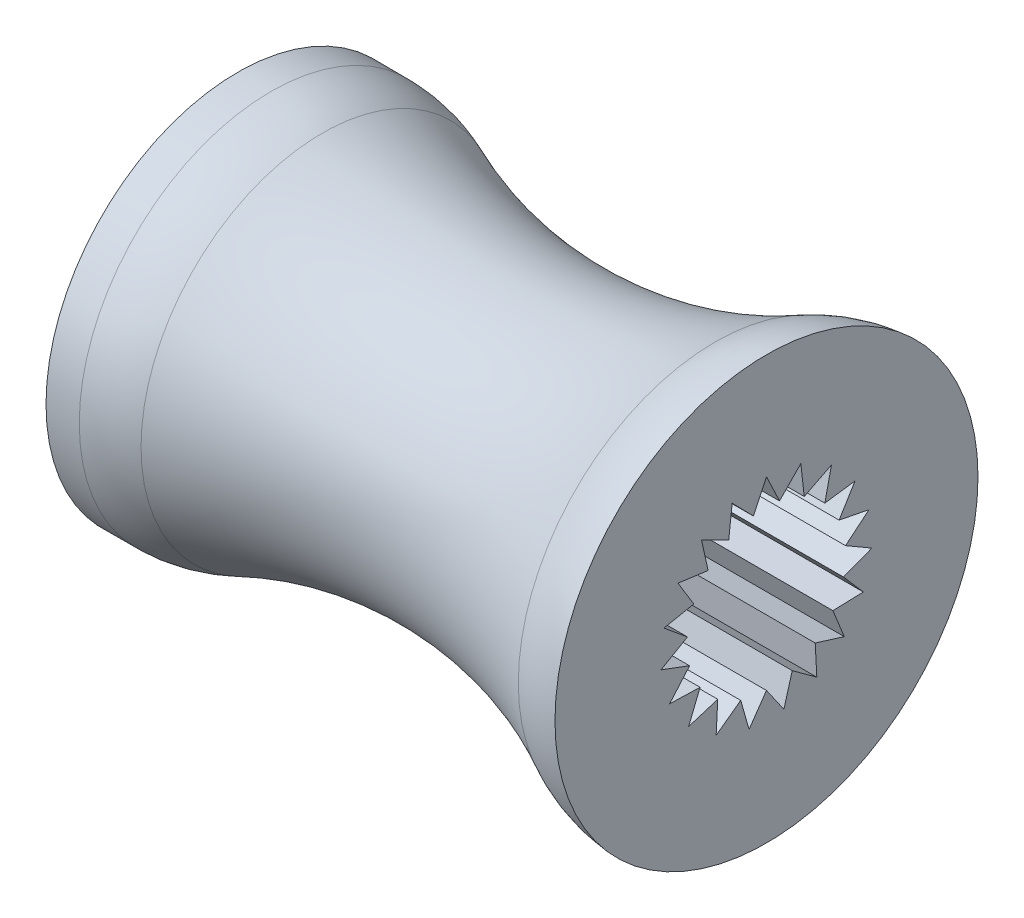
from build123d import *

# Parameters (mm, degrees)
CUT_EXTRUDE1_DEPTH = 46.95650117230423
FILLET1_R          = 10


with BuildPart() as part:
    # Sketch1 → Revolve1 (revolve)
    with BuildSketch(Plane.XY, mode=Mode.PRIVATE) as revolve1_sk:
        with BuildLine():
            Line((-20, 4.7625), (-20, 14.5))
            Line((-20, 14.5), (-15.328636266651278, 14.5))
            ThreePointArc((-15.328636266651278, 14.5), (1.5695766523512105, 11), (18.08622279664887, 16))
            Line((18.08622279664887, 16), (20, 16))
            Line((20, 16), (20, 4.7625))
            Line((20, 4.7625), (16.825, 4.7625))
            Line((16.825, 4.7625), (16.825, 3.96875))
            Line((16.825, 3.96875), (-16.825, 3.96875))
            Line((-16.825, 3.96875), (-16.825, 4.7625))
            Line((-16.825, 4.7625), (-20, 4.7625))
        make_face()
    revolve(revolve1_sk.sketch.rotate(Axis((-20, 0, 0), (1, 0, 0)), 90), axis=Axis((-20, 0, 0), (1, 0, 0)))

    # Sketch2 → Cut-Extrude1 (cut, through all)
    with BuildSketch(Plane(origin=(20, 0, 0), x_dir=(0, 0, -1), z_dir=(1, 0, 0))):
        Polygon((-0.9875675416844027, 5.918167820416334), (0, 8), (0.9875675416844045, 5.918167820416334), (2.5975957536374685, 7.56653793360508), (2.855684358222442, 5.276842507238936), (4.913701701517343, 6.313124075171151), (4.414343464038791, 4.06368942975445), (6.69733182610023, 4.375585264979419), (5.494639959930347, 2.4101725479178207), (7.7552021275146465, 1.9638838971263979), (5.979506958040023, 0.4954760728339973), (7.972675944053363, -0.6606347637786543), (5.8164015956359885, -1.47291292284479), (7.326186613240466, -3.2135633972237505), (5.022998869575178, -3.2816889487345575), (5.885791285385062, -5.418252573005925), (3.685276276138015, -4.7348430563783594), (3.807579144296598, -7.035790009651912), (1.948196815228109, -5.674903450203807), (1.3167567222458805, -7.890890427221779), (8.4e-15, -6), (-1.3167567222458623, -7.8908904272217795), (-1.9481968152280928, -5.674903450203809), (-3.80757914429658, -7.035790009651914), (-3.685276276137998, -4.7348430563783666), (-5.885791285385044, -5.418252573005935), (-5.022998869575163, -3.2816889487345664), (-7.326186613240452, -3.213563397223763), (-5.816401595635977, -1.4729129228448008), (-7.9726759440533534, -0.6606347637786659), (-5.979506958040015, 0.4954760728339881), (-7.75520212751464, 1.9638838971263866), (-5.4946399599303435, 2.4101725479178118), (-6.697331826100229, 4.375585264979409), (-4.41434346403879, 4.063689429754444), (-4.913701701517344, 6.313124075171145), (-2.855684358222442, 5.276842507238932), (-2.5975957536374694, 7.566537933605075), align=None)
    extrude(amount=-CUT_EXTRUDE1_DEPTH, mode=Mode.SUBTRACT)

    # Fillet1
    # the kernel refuses this fillet: 10 mm, written as the material it takes off along each edge
    with BuildSketch(Plane(origin=(18.08622279664887, 0, 0), x_dir=(0, 1.1e-16, 1), z_dir=(0, 1, -1.1e-16))) as fillet1_piece_1:
        with BuildLine():
            CenterArc((6.027123801609688, 2.6498073192975404), FILLET1_R, 332.5612146984912, 23.217826405433588)
            Line((15.999999999999996, 1.913777203351131), (16.1994575239678, 1.8990566010322034))
            ThreePointArc((16.1994575239678, 1.8990566010322034), (16.2, 0.9568886016755656), (16.199999999999996, 0))
            Line((16.199999999999996, 0), (16.17122736238995, -0.10334984455228025))
            ThreePointArc((16.17122736238995, -0.10334984455228025), (15.609829730901891, -1.0681006002986955), (15.079661114712898, -2.050359506983643))
            Line((15.079661114712898, -2.050359506983643), (14.902160383083423, -1.9581993731349918))
        make_face()
    revolve(axis=Axis((18.08622279664887, 0, 0), (1, 0, 0)), mode=Mode.SUBTRACT)
    with BuildSketch(Plane(origin=(-15.328636266651278, 0, 0), x_dir=(0, 1.1e-16, 1), z_dir=(0, 1, -1.1e-16))) as fillet1_piece_2:
        with BuildLine():
            CenterArc((4.5, -2.1548222421926884), FILLET1_R, 0, 22.862521626171226)
            Line((13.714397426275884, 1.7303907597726322), (13.898685374801401, 1.8080950198119385))
            ThreePointArc((13.898685374801401, 1.8080950198119385), (14.277562788256734, 0.9425411788785816), (14.67979879096138, 0.08759220723800709))
            Line((14.67979879096138, 0.08759220723800709), (14.7, 0))
            Line((14.7, 0), (14.7, -2.1548222421926884))
            Line((14.7, -2.1548222421926884), (14.5, -2.1548222421926884))
        make_face()
    revolve(axis=Axis((-15.328636266651278, 0, 0), (1, 0, 0)), mode=Mode.SUBTRACT)


solid = part.part
